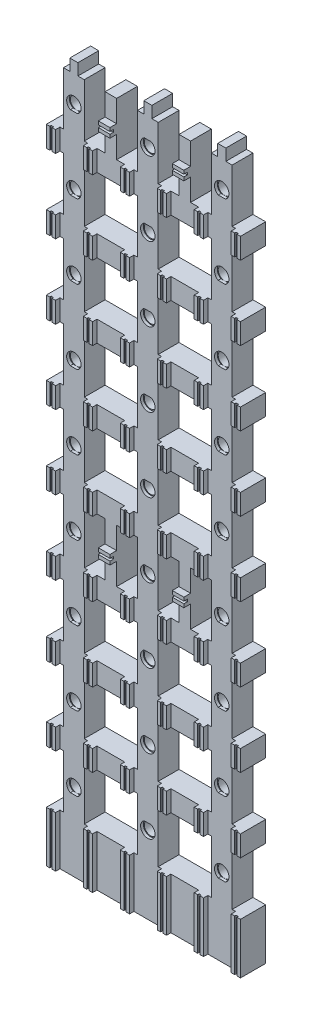
from build123d import *

# Parameters (mm, degrees)
SKETCH1_W            = 84
SKETCH1_H            = 22
BOSS_EXTRUDE1_DEPTH  = 9
BOSS_EXTRUDE2_DEPTH  = 9
LPATTERN1_COUNT      = 3
LPATTERN1_PITCH      = 32
SKETCH3_W            = 84
SKETCH3_H            = 9
BOSS_EXTRUDE3_DEPTH  = 9
LPATTERN2_COUNT      = 8
LPATTERN2_PITCH      = 32
SKETCH4_W            = 5
SKETCH4_H            = 23
BOSS_EXTRUDE4_DEPTH  = 9
LPATTERN3_COUNT      = 2
LPATTERN3_PITCH      = 32
LPATTERN3_COUNT_DIR2 = 2
LPATTERN3_PITCH_DIR2 = 160
SKETCH5_R            = 2.725
CUT_EXTRUDE1_DEPTH   = 299.110717687
CUT_EXTRUDE2_DEPTH   = 1.2
SKETCH7_W            = 4
SKETCH7_H            = 22
BOSS_EXTRUDE5_DEPTH  = 1.9
SKETCH8_W            = 4
SKETCH8_H            = 9
BOSS_EXTRUDE6_DEPTH  = 1.9
LPATTERN4_COUNT      = 8
LPATTERN4_PITCH      = 32
SKETCH9_W            = 1
SKETCH9_H            = 22
CUT_EXTRUDE3_DEPTH   = 0.6
LPATTERN5_COUNT      = 6
LPATTERN5_PITCH      = 16
LPATTERN5_COUNT_DIR2 = 9
LPATTERN5_PITCH_DIR2 = 32
SKETCH10_W           = 5
SKETCH10_H           = 4
BOSS_EXTRUDE7_DEPTH  = 2.9
LPATTERN6_COUNT      = 2
LPATTERN6_PITCH      = 32
LPATTERN6_COUNT_DIR2 = 2
LPATTERN6_PITCH_DIR2 = 160
SKETCH11_W           = 5
SKETCH11_H           = 1
CUT_EXTRUDE4_DEPTH   = 1.5
LPATTERN7_COUNT      = 2
LPATTERN7_PITCH      = 32
LPATTERN7_COUNT_DIR2 = 2
LPATTERN7_PITCH_DIR2 = 160


with BuildPart() as part:
    # Sketch1 → Boss-Extrude1 (new body)
    with BuildSketch(Plane.XY):
        Rectangle(SKETCH1_W, SKETCH1_H)
    extrude(amount=BOSS_EXTRUDE1_DEPTH)

    # Sketch2 → Boss-Extrude2 (add)
    with BuildSketch(Plane.XY.offset(9)):
        Polygon((-36.5, 11), (-27.5, 11), (-27.5, 290), (-30.25, 290), (-30.25, 295), (-33.75, 295), (-33.75, 290), (-36.5, 290), align=None)
    boss_extrude2 = extrude(amount=-BOSS_EXTRUDE2_DEPTH)

    # LPattern1: Boss-Extrude2 ×3
    with Locations(*[(i * LPATTERN1_PITCH, 0, 0) for i in range(1, LPATTERN1_COUNT)]):
        add(boss_extrude2)

    # Sketch3 → Boss-Extrude3 (add)
    with BuildSketch(Plane.XY.offset(9)):
        with Locations((0, 38.5)):
            Rectangle(SKETCH3_W, SKETCH3_H)
    boss_extrude3 = extrude(amount=-BOSS_EXTRUDE3_DEPTH)

    # LPattern2: Boss-Extrude3 ×8
    with Locations(*[(0, i * LPATTERN2_PITCH, 0) for i in range(1, LPATTERN2_COUNT)]):
        add(boss_extrude3)

    # Sketch4 → Boss-Extrude4 (add)
    with BuildSketch(Plane.XY.offset(9)):
        with Locations((-16, 118.5)):
            Rectangle(SKETCH4_W, SKETCH4_H)
    boss_extrude4 = extrude(amount=-BOSS_EXTRUDE4_DEPTH)

    # LPattern3: Boss-Extrude4 2 × 2
    with Locations(*[(i * LPATTERN3_PITCH, j * LPATTERN3_PITCH_DIR2, 0) for i in range(LPATTERN3_COUNT) for j in range(LPATTERN3_COUNT_DIR2) if (i, j) != (0, 0)]):
        add(boss_extrude4)

    # Sketch5 → Cut-Extrude1 (cut, through all)
    with BuildSketch(Plane.XY.offset(9)):
        with Locations((-32, 22.5)):
            Circle(SKETCH5_R)
        with Locations((0, 22.5)):
            Circle(SKETCH5_R)
        with Locations((32, 22.5)):
            Circle(SKETCH5_R)
        with Locations((-32, 54.5)):
            Circle(SKETCH5_R)
        with Locations((0, 54.5)):
            Circle(SKETCH5_R)
        with Locations((32, 54.5)):
            Circle(SKETCH5_R)
        with Locations((-32, 86.5)):
            Circle(SKETCH5_R)
        with Locations((0, 86.5)):
            Circle(SKETCH5_R)
        with Locations((32, 86.5)):
            Circle(SKETCH5_R)
        with Locations((-32, 118.5)):
            Circle(SKETCH5_R)
        with Locations((0, 118.5)):
            Circle(SKETCH5_R)
        with Locations((32, 118.5)):
            Circle(SKETCH5_R)
        with Locations((-32, 150.5)):
            Circle(SKETCH5_R)
        with Locations((0, 150.5)):
            Circle(SKETCH5_R)
        with Locations((32, 150.5)):
            Circle(SKETCH5_R)
        with Locations((-32, 182.5)):
            Circle(SKETCH5_R)
        with Locations((0, 182.5)):
            Circle(SKETCH5_R)
        with Locations((32, 182.5)):
            Circle(SKETCH5_R)
        with Locations((-32, 214.5)):
            Circle(SKETCH5_R)
        with Locations((0, 214.5)):
            Circle(SKETCH5_R)
        with Locations((32, 214.5)):
            Circle(SKETCH5_R)
        with Locations((-32, 246.5)):
            Circle(SKETCH5_R)
        with Locations((0, 246.5)):
            Circle(SKETCH5_R)
        with Locations((32, 246.5)):
            Circle(SKETCH5_R)
        with Locations((-32, 278.5)):
            Circle(SKETCH5_R)
        with Locations((0, 278.5)):
            Circle(SKETCH5_R)
        with Locations((32, 278.5)):
            Circle(SKETCH5_R)
    extrude(amount=-CUT_EXTRUDE1_DEPTH, mode=Mode.SUBTRACT)

    # Sketch6 → Cut-Extrude2 (cut)
    with BuildSketch(Plane.XY.offset(9)):
        with BuildLine():
            Line((-33.529705854, 19.775), (-30.470294146, 19.775))
            ThreePointArc((-30.470294146, 19.775), (-32, 25.625), (-33.529705854, 19.775))
        make_face()
        with BuildLine():
            Line((-1.529705854, 25.225), (1.529705854, 25.225))
            ThreePointArc((1.529705854, 25.225), (0, 19.375), (-1.529705854, 25.225))
        make_face()
        with BuildLine():
            Line((30.470294146, 19.775), (33.529705854, 19.775))
            ThreePointArc((33.529705854, 19.775), (32, 25.625), (30.470294146, 19.775))
        make_face()
        with BuildLine():
            Line((-33.529705854, 51.775), (-30.470294146, 51.775))
            ThreePointArc((-30.470294146, 51.775), (-32, 57.625), (-33.529705854, 51.775))
        make_face()
        with BuildLine():
            Line((-1.529705854, 57.225), (1.529705854, 57.225))
            ThreePointArc((1.529705854, 57.225), (0, 51.375), (-1.529705854, 57.225))
        make_face()
        with BuildLine():
            Line((30.470294146, 51.775), (33.529705854, 51.775))
            ThreePointArc((33.529705854, 51.775), (32, 57.625), (30.470294146, 51.775))
        make_face()
        with BuildLine():
            Line((-33.529705854, 83.775), (-30.470294146, 83.775))
            ThreePointArc((-30.470294146, 83.775), (-32, 89.625), (-33.529705854, 83.775))
        make_face()
        with BuildLine():
            Line((-1.529705854, 89.225), (1.529705854, 89.225))
            ThreePointArc((1.529705854, 89.225), (0, 83.375), (-1.529705854, 89.225))
        make_face()
        with BuildLine():
            Line((30.470294146, 83.775), (33.529705854, 83.775))
            ThreePointArc((33.529705854, 83.775), (32, 89.625), (30.470294146, 83.775))
        make_face()
        with BuildLine():
            Line((-33.529705854, 115.775), (-30.470294146, 115.775))
            ThreePointArc((-30.470294146, 115.775), (-32, 121.625), (-33.529705854, 115.775))
        make_face()
        with BuildLine():
            Line((-1.529705854, 121.225), (1.529705854, 121.225))
            ThreePointArc((1.529705854, 121.225), (0, 115.375), (-1.529705854, 121.225))
        make_face()
        with BuildLine():
            Line((30.470294146, 115.775), (33.529705854, 115.775))
            ThreePointArc((33.529705854, 115.775), (32, 121.625), (30.470294146, 115.775))
        make_face()
        with BuildLine():
            Line((-33.529705854, 147.775), (-30.470294146, 147.775))
            ThreePointArc((-30.470294146, 147.775), (-32, 153.625), (-33.529705854, 147.775))
        make_face()
        with BuildLine():
            Line((-1.529705854, 153.225), (1.529705854, 153.225))
            ThreePointArc((1.529705854, 153.225), (0, 147.375), (-1.529705854, 153.225))
        make_face()
        with BuildLine():
            Line((30.470294146, 147.775), (33.529705854, 147.775))
            ThreePointArc((33.529705854, 147.775), (32, 153.625), (30.470294146, 147.775))
        make_face()
        with BuildLine():
            Line((-33.529705854, 179.775), (-30.470294146, 179.775))
            ThreePointArc((-30.470294146, 179.775), (-32, 185.625), (-33.529705854, 179.775))
        make_face()
        with BuildLine():
            Line((-1.529705854, 185.225), (1.529705854, 185.225))
            ThreePointArc((1.529705854, 185.225), (0, 179.375), (-1.529705854, 185.225))
        make_face()
        with BuildLine():
            Line((30.470294146, 179.775), (33.529705854, 179.775))
            ThreePointArc((33.529705854, 179.775), (32, 185.625), (30.470294146, 179.775))
        make_face()
        with BuildLine():
            Line((-33.529705854, 211.775), (-30.470294146, 211.775))
            ThreePointArc((-30.470294146, 211.775), (-32, 217.625), (-33.529705854, 211.775))
        make_face()
        with BuildLine():
            Line((-1.529705854, 217.225), (1.529705854, 217.225))
            ThreePointArc((1.529705854, 217.225), (0, 211.375), (-1.529705854, 217.225))
        make_face()
        with BuildLine():
            Line((30.470294146, 211.775), (33.529705854, 211.775))
            ThreePointArc((33.529705854, 211.775), (32, 217.625), (30.470294146, 211.775))
        make_face()
        with BuildLine():
            Line((-33.529705854, 243.775), (-30.470294146, 243.775))
            ThreePointArc((-30.470294146, 243.775), (-32, 249.625), (-33.529705854, 243.775))
        make_face()
        with BuildLine():
            Line((-1.529705854, 249.225), (1.529705854, 249.225))
            ThreePointArc((1.529705854, 249.225), (0, 243.375), (-1.529705854, 249.225))
        make_face()
        with BuildLine():
            Line((30.470294146, 243.775), (33.529705854, 243.775))
            ThreePointArc((33.529705854, 243.775), (32, 249.625), (30.470294146, 243.775))
        make_face()
        with BuildLine():
            Line((-33.529705854, 275.775), (-30.470294146, 275.775))
            ThreePointArc((-30.470294146, 275.775), (-32, 281.625), (-33.529705854, 275.775))
        make_face()
        with BuildLine():
            Line((-1.529705854, 281.225), (1.529705854, 281.225))
            ThreePointArc((1.529705854, 281.225), (0, 275.375), (-1.529705854, 281.225))
        make_face()
        with BuildLine():
            Line((30.470294146, 275.775), (33.529705854, 275.775))
            ThreePointArc((33.529705854, 275.775), (32, 281.625), (30.470294146, 275.775))
        make_face()
    extrude(amount=-CUT_EXTRUDE2_DEPTH, mode=Mode.SUBTRACT)

    # Sketch7 → Boss-Extrude5 (add)
    with BuildSketch(Plane.XY.offset(9)):
        with Locations((-40, 0)):
            Rectangle(SKETCH7_W, SKETCH7_H)
        with Locations((-24, 0)):
            Rectangle(SKETCH7_W, SKETCH7_H)
        with Locations((-8, 0)):
            Rectangle(SKETCH7_W, SKETCH7_H)
        with Locations((8, 0)):
            Rectangle(SKETCH7_W, SKETCH7_H)
        with Locations((24, 0)):
            Rectangle(SKETCH7_W, SKETCH7_H)
        with Locations((40, 0)):
            Rectangle(SKETCH7_W, SKETCH7_H)
    extrude(amount=BOSS_EXTRUDE5_DEPTH)

    # Sketch8 → Boss-Extrude6 (add)
    with BuildSketch(Plane.XY.offset(9)):
        with Locations((-40, 38.5)):
            Rectangle(SKETCH8_W, SKETCH8_H)
        with Locations((-24, 38.5)):
            Rectangle(SKETCH8_W, SKETCH8_H)
        with Locations((-8, 38.5)):
            Rectangle(SKETCH8_W, SKETCH8_H)
        with Locations((8, 38.5)):
            Rectangle(SKETCH8_W, SKETCH8_H)
        with Locations((24, 38.5)):
            Rectangle(SKETCH8_W, SKETCH8_H)
        with Locations((40, 38.5)):
            Rectangle(SKETCH8_W, SKETCH8_H)
    boss_extrude6 = extrude(amount=BOSS_EXTRUDE6_DEPTH)

    # LPattern4: Boss-Extrude6 ×8
    with Locations(*[(0, i * LPATTERN4_PITCH, 0) for i in range(1, LPATTERN4_COUNT)]):
        add(boss_extrude6)

    # Sketch9 → Cut-Extrude3 (cut)
    with BuildSketch(Plane.XY.offset(10.9)):
        with Locations((-40, 0)):
            Rectangle(SKETCH9_W, SKETCH9_H)
    cut_extrude3 = extrude(amount=-CUT_EXTRUDE3_DEPTH, mode=Mode.SUBTRACT)

    # LPattern5: Cut-Extrude3 6 × 9
    with Locations(*[(i * LPATTERN5_PITCH, j * LPATTERN5_PITCH_DIR2, 0) for i in range(LPATTERN5_COUNT) for j in range(LPATTERN5_COUNT_DIR2) if (i, j) != (0, 0)]):
        add(cut_extrude3, mode=Mode.SUBTRACT)

    # Sketch10 → Boss-Extrude7 (add)
    with BuildSketch(Plane.XY.offset(9)):
        with Locations((-16, 118.5)):
            Rectangle(SKETCH10_W, SKETCH10_H)
    boss_extrude7 = extrude(amount=BOSS_EXTRUDE7_DEPTH)

    # LPattern6: Boss-Extrude7 2 × 2
    with Locations(*[(i * LPATTERN6_PITCH, j * LPATTERN6_PITCH_DIR2, 0) for i in range(LPATTERN6_COUNT) for j in range(LPATTERN6_COUNT_DIR2) if (i, j) != (0, 0)]):
        add(boss_extrude7)

    # Sketch11 → Cut-Extrude4 (cut)
    with BuildSketch(Plane.XY.offset(11.9)):
        with Locations((-16, 118.5)):
            Rectangle(SKETCH11_W, SKETCH11_H)
    cut_extrude4 = extrude(amount=-CUT_EXTRUDE4_DEPTH, mode=Mode.SUBTRACT)

    # LPattern7: Cut-Extrude4 2 × 2
    with Locations(*[(i * LPATTERN7_PITCH, j * LPATTERN7_PITCH_DIR2, 0) for i in range(LPATTERN7_COUNT) for j in range(LPATTERN7_COUNT_DIR2) if (i, j) != (0, 0)]):
        add(cut_extrude4, mode=Mode.SUBTRACT)


solid = part.part
